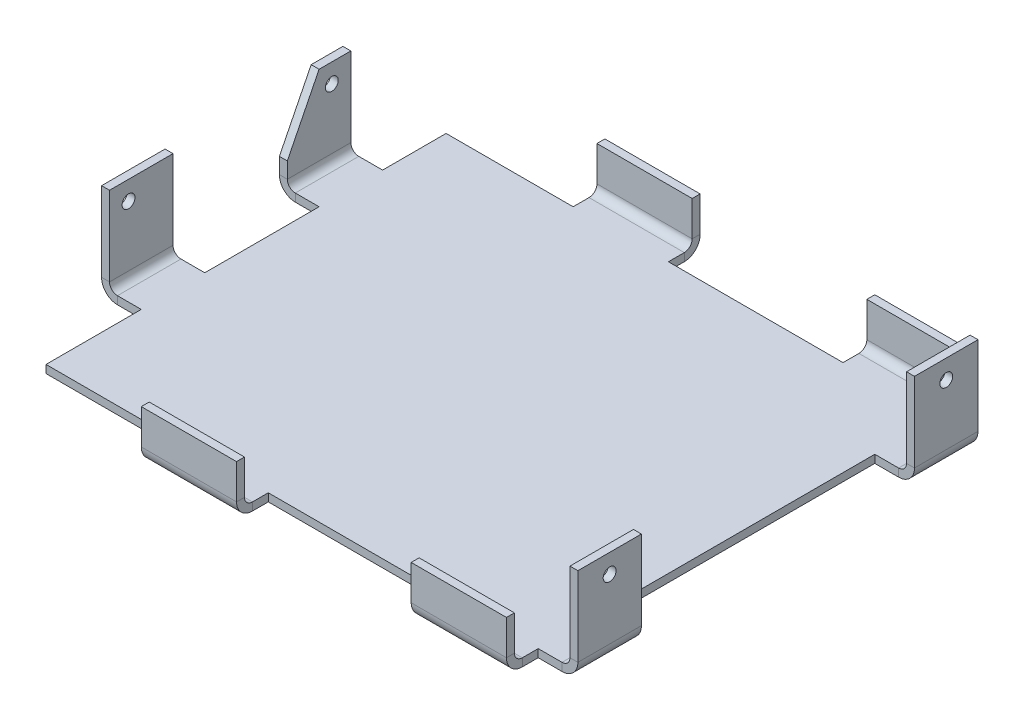
from build123d import *

# Parameters (mm, degrees)
BASE_FLANGE1_DEPTH               = 160.02
SKETCH17_W                       = 196.85
SKETCH17_H                       = 12.7
BOSS_EXTRUDE2_DEPTH              = 3.175
EDGE_FLANGE1_STRIP_W             = 19.05
EDGE_FLANGE1_STRIP_H             = 3.175
EDGE_FLANGE1_STRIP_CUT_DEPTH     = 196.85
EDGE_FLANGE1_DEPTH               = 196.85
CUT_EXTRUDE3_REACH               = 291.036
SKETCH24_R                       = 2.5796875
SKETCH24_W                       = 45.72
SKETCH24_H                       = 50.8
SKETCH24_W_2                     = 38.1
SKETCH24_W_3                     = 25.4
F_13_64_0_20313_DIAMETER_HOLE1_D = 5.159502
CUT_EXTRUDE4_REACH               = 291.036
SKETCH28_W                       = 109.22
SKETCH28_H                       = 50.8
SKETCH29_W                       = 69.85
SKETCH29_H                       = 12.7
SKETCH29_W_2                     = 50.8
CUT_EXTRUDE5_DEPTH               = 290.035929254
CHAMFER1_SIZE                    = 12.7
CHAMFER1_SIZE2                   = 25.4


# Sheet-metal steps are written as plain solids
with BuildPart() as part:
    # Sketch7 → Base-Flange1 (new body)
    with BuildSketch(Plane.XY):
        with BuildLine():
            Line((-228.6, 38.1), (-228.6, 6.35))
            ThreePointArc((-228.6, 6.35), (-226.740128061, 1.859871939), (-222.25, 0))
            Line((-222.25, 0), (-6.35, 0))
            ThreePointArc((-6.35, 0), (-1.859871939, 1.859871939), (0, 6.35))
            Line((0, 6.35), (0, 38.1))
            Line((0, 38.1), (-3.175, 38.1))
            Line((-3.175, 38.1), (-3.175, 6.35))
            ThreePointArc((-3.175, 6.35), (-4.10493597, 4.10493597), (-6.35, 3.175))
            Line((-6.35, 3.175), (-222.25, 3.175))
            ThreePointArc((-222.25, 3.175), (-224.49506403, 4.10493597), (-225.425, 6.35))
            Line((-225.425, 6.35), (-225.425, 38.1))
            Line((-225.425, 38.1), (-228.6, 38.1))
        make_face()
    extrude(amount=BASE_FLANGE1_DEPTH)

    # Sketch17 → Boss-Extrude2 (add)
    with BuildSketch(Plane(origin=(0, 3.175, 0), x_dir=(1, 0, 0), z_dir=(0, 1, 0))):
        with Locations((-114.3, -166.37)):
            Rectangle(SKETCH17_W, SKETCH17_H)
    boss_extrude2 = extrude(amount=-BOSS_EXTRUDE2_DEPTH)

    # Edge-Flange1 strip (across the edge) → Edge-Flange1 strip cut (cut)
    with BuildSketch(Plane(origin=(-212.725, 3.175, 172.72), x_dir=(0, 0, -1), z_dir=(1, 0, 0))):
        with Locations((-3.175, -1.5875)):
            Rectangle(EDGE_FLANGE1_STRIP_W, EDGE_FLANGE1_STRIP_H)
    edge_flange1_strip_cut = extrude(amount=EDGE_FLANGE1_STRIP_CUT_DEPTH, mode=Mode.SUBTRACT)

    # Edge-Flange1 section (across the edge) → Edge-Flange1 (add)
    with BuildSketch(Plane(origin=(-212.725, 3.175, 172.72), x_dir=(0, 0, -1), z_dir=(1, 0, 0))):
        with BuildLine():
            Line((0, 3.175), (0, 17.145))
            Line((0, 17.145), (3.175, 17.145))
            Line((3.175, 17.145), (3.175, 3.175))
            ThreePointArc((3.175, 3.175), (4.10493597, 0.92993597), (6.35, 0))
            Line((6.35, 0), (6.35, -3.175))
            ThreePointArc((6.35, -3.175), (1.859871939, -1.315128061), (0, 3.175))
        make_face()
    edge_flange1 = extrude(amount=EDGE_FLANGE1_DEPTH)

    # Mirror1: Boss-Extrude2, Edge-Flange1 strip cut, Edge-Flange1 across plane
    add(boss_extrude2.mirror(Plane.XY.offset(80.01)))
    add(edge_flange1_strip_cut.mirror(Plane.XY.offset(80.01)), mode=Mode.SUBTRACT)
    add(edge_flange1.mirror(Plane.XY.offset(80.01)))

    # Cut-Extrude3: up to this face of the body (flat: up to its plane)
    cut_extrude3_end = Plane(part.part.faces().sort_by_distance((-212.725, 2.935376879, 163.195))[0])
    # Sketch24 → Cut-Extrude3 (cut, up to the picked face)
    with BuildSketch(Plane.ZY.offset(228.6), mode=Mode.PRIVATE) as cut_extrude3_sk1:
        with Locations(Location((33.02, 30.48, 0), (0, 0, 180))):
            Circle(SKETCH24_R)
    cut_extrude3_tool1 = split(extrude(cut_extrude3_sk1.sketch, amount=-CUT_EXTRUDE3_REACH, mode=Mode.PRIVATE), bisect_by=cut_extrude3_end, keep=Keep.BOTH, mode=Mode.PRIVATE)
    # Sketch24 → Cut-Extrude3 (cut, up to the picked face)
    with BuildSketch(Plane.ZY.offset(228.6), mode=Mode.PRIVATE) as cut_extrude3_sk2:
        with Locations(Location((114.3, 30.48, 0), (0, 0, 180))):
            Circle(SKETCH24_R)
    cut_extrude3_tool2 = split(extrude(cut_extrude3_sk2.sketch, amount=-CUT_EXTRUDE3_REACH, mode=Mode.PRIVATE), bisect_by=cut_extrude3_end, keep=Keep.BOTH, mode=Mode.PRIVATE)
    # Sketch24 → Cut-Extrude3 (cut, up to the picked face)
    with BuildSketch(Plane.ZY.offset(228.6), mode=Mode.PRIVATE) as cut_extrude3_sk3:
        with Locations((73.66, 12.7)):
            Rectangle(SKETCH24_W, SKETCH24_H)
    cut_extrude3_tool3 = split(extrude(cut_extrude3_sk3.sketch, amount=-CUT_EXTRUDE3_REACH, mode=Mode.PRIVATE), bisect_by=cut_extrude3_end, keep=Keep.BOTH, mode=Mode.PRIVATE)
    # Sketch24 → Cut-Extrude3 (cut, up to the picked face)
    with BuildSketch(Plane.ZY.offset(228.6), mode=Mode.PRIVATE) as cut_extrude3_sk4:
        with Locations((140.97, 12.7)):
            Rectangle(SKETCH24_W_2, SKETCH24_H)
    cut_extrude3_tool4 = split(extrude(cut_extrude3_sk4.sketch, amount=-CUT_EXTRUDE3_REACH, mode=Mode.PRIVATE), bisect_by=cut_extrude3_end, keep=Keep.BOTH, mode=Mode.PRIVATE)
    # Sketch24 → Cut-Extrude3 (cut, up to the picked face)
    with BuildSketch(Plane.ZY.offset(228.6), mode=Mode.PRIVATE) as cut_extrude3_sk5:
        with Locations((12.7, 12.7)):
            Rectangle(SKETCH24_W_3, SKETCH24_H)
    cut_extrude3_tool5 = split(extrude(cut_extrude3_sk5.sketch, amount=-CUT_EXTRUDE3_REACH, mode=Mode.PRIVATE), bisect_by=cut_extrude3_end, keep=Keep.BOTH, mode=Mode.PRIVATE)
    add(cut_extrude3_tool1.solids().sort_by(Axis((-228.6, 30.48, 33.02), (1, 0, 0)))[0], mode=Mode.SUBTRACT)
    add(cut_extrude3_tool2.solids().sort_by(Axis((-228.6, 30.48, 114.3), (1, 0, 0)))[0], mode=Mode.SUBTRACT)
    add(cut_extrude3_tool3.solids().sort_by(Axis((-228.6, 12.7, 73.66), (1, 0, 0)))[0], mode=Mode.SUBTRACT)
    add(cut_extrude3_tool4.solids().sort_by(Axis((-228.6, 12.7, 140.97), (1, 0, 0)))[0], mode=Mode.SUBTRACT)
    add(cut_extrude3_tool5.solids().sort_by(Axis((-228.6, 12.7, 12.7), (1, 0, 0)))[0], mode=Mode.SUBTRACT)

    # 13/64 (0.20313) Diameter Hole1 (through all)
    with Locations(Plane(origin=(0, 0, 0), x_dir=(0, 0, -1), z_dir=(1, 0, 0))):
        with Locations((-147.32, 30.48), (-12.7, 30.48)):
            Hole(F_13_64_0_20313_DIAMETER_HOLE1_D / 2)

    # Cut-Extrude4: up to this face of the body (flat: up to its plane)
    cut_extrude4_end = Plane(part.part.faces().sort_by_distance((-15.875, 2.935376879, -3.175))[0])
    # Sketch28 → Cut-Extrude4 (cut, up to the picked face)
    with BuildSketch(Plane(origin=(0, 0, 0), x_dir=(0, 0, -1), z_dir=(1, 0, 0)), mode=Mode.PRIVATE) as cut_extrude4_sk1:
        with Locations((-80.01, 12.7)):
            Rectangle(SKETCH28_W, SKETCH28_H)
    cut_extrude4_tool1 = split(extrude(cut_extrude4_sk1.sketch, amount=-CUT_EXTRUDE4_REACH, mode=Mode.PRIVATE), bisect_by=cut_extrude4_end, keep=Keep.BOTH, mode=Mode.PRIVATE)
    add(cut_extrude4_tool1.solids().sort_by(Axis((0, 12.7, 80.01), (-1, 0, 0)))[0], mode=Mode.SUBTRACT)

    # Sketch29 → Cut-Extrude5 (cut, through all)
    with BuildSketch(Plane(origin=(0, 0, 0), x_dir=(-1, 0, 0), z_dir=(0, -1, 0))):
        with Locations((88.9, -166.37)):
            Rectangle(SKETCH29_W, SKETCH29_H)
        with Locations((88.9, 6.35)):
            Rectangle(SKETCH29_W, SKETCH29_H)
        with Locations((187.325, -166.37)):
            Rectangle(SKETCH29_W_2, SKETCH29_H)
        with Locations((187.325, 6.35)):
            Rectangle(SKETCH29_W_2, SKETCH29_H)
    extrude(amount=-CUT_EXTRUDE5_DEPTH, mode=Mode.SUBTRACT)

    # Chamfer1
    chamfer1_edges = [part.edges().sort_by_distance(p)[0] for p in [
        (-227.0125, 38.1, 50.8),
    ]]
    chamfer1_side = [part.faces().sort_by_distance(p)[0] for p in [
        (-227.0125, 38.1, 38.1),
    ]]
    chamfer(chamfer1_edges, length=CHAMFER1_SIZE, length2=CHAMFER1_SIZE2, reference=chamfer1_side[0])


solid = part.part
